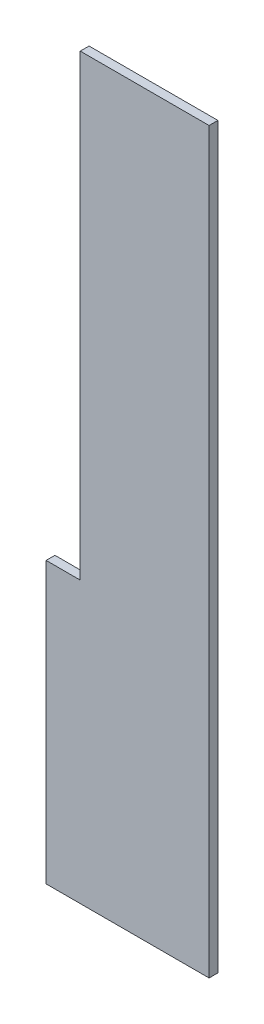
from build123d import *

# Parameters (mm, degrees)
TABAN_FLAN_1_DEPTH         = 40
KES_EKSTR_ZYON1_DEPTH      = 6158.209189235
KES_EKSTR_ZYON1_DEPTH_BACK = 6158.209189235
IZIM2_W                    = 1360
IZIM2_H                    = 355
KES_EKSTR_ZYON2_DEPTH      = 6158.209189235
KES_EKSTR_ZYON2_DEPTH_BACK = 6158.209189235
IZIM3_W                    = 365
IZIM3_H                    = 3110
IZIM3_W_2                  = 5
IZIM3_H_2                  = 5650
KES_EKSTR_ZYON3_DEPTH      = 6157.106724221
KES_EKSTR_ZYON3_DEPTH_BACK = 6157.106724221
IZIM4_W                    = 405
IZIM4_H                    = 3110
KES_EKSTR_ZYON4_DEPTH      = 6157.106724221
KES_EKSTR_ZYON4_DEPTH_BACK = 6157.106724221
KES_EKSTR_ZYON5_DEPTH      = 4928.148668348
KES_EKSTR_ZYON5_DEPTH_BACK = 4928.148668348
IZIM6_W                    = 585
IZIM6_H                    = 1030


# Sheet-metal steps are written as plain solids
with BuildPart() as part:
    # Çizim1 → Taban-Flanş1 (new body)
    with BuildSketch(Plane.XY):
        Polygon((0, 0), (0, -3465), (-660, -3465), (-660, -6005), (1360, -6005), (1360, 0), align=None)
    extrude(amount=-TABAN_FLAN_1_DEPTH)

    # Çizim2 → Kes-Ekstrüzyon1 (cut, two sides: drawn at the far end of the back side and taken through both)
    with BuildSketch(Plane.XY.offset(-KES_EKSTR_ZYON1_DEPTH_BACK)):
        with Locations((680, -177.5)):
            Rectangle(IZIM2_W, IZIM2_H)
    extrude(amount=KES_EKSTR_ZYON1_DEPTH + KES_EKSTR_ZYON1_DEPTH_BACK, mode=Mode.SUBTRACT)

    # Çizim3 → Kes-Ekstrüzyon2 (cut, two sides: drawn at the far end of the back side and taken through both)
    with BuildSketch(Plane.XY.offset(-KES_EKSTR_ZYON2_DEPTH_BACK)):
        with Locations((182.5, -1910)):
            Rectangle(IZIM3_W, IZIM3_H)
        with Locations((1357.5, -3180)):
            Rectangle(IZIM3_W_2, IZIM3_H_2)
    extrude(amount=KES_EKSTR_ZYON2_DEPTH + KES_EKSTR_ZYON2_DEPTH_BACK, mode=Mode.SUBTRACT)

    # Çizim4 → Kes-Ekstrüzyon3 (cut, two sides: drawn at the far end of the back side and taken through both)
    with BuildSketch(Plane.XY.offset(-KES_EKSTR_ZYON3_DEPTH_BACK)):
        with Locations((567.5, -1910)):
            Rectangle(IZIM4_W, IZIM4_H)
    extrude(amount=KES_EKSTR_ZYON3_DEPTH + KES_EKSTR_ZYON3_DEPTH_BACK, mode=Mode.SUBTRACT)

    # Çizim5 → Kes-Ekstrüzyon4 (cut, two sides: drawn at the far end of the back side and taken through both)
    with BuildSketch(Plane.XY.offset(-KES_EKSTR_ZYON4_DEPTH_BACK)):
        Polygon((615, -3465), (615, -4737), (1355, -4737), (1355, -6005), (-660, -6005), (-660, -3465), align=None)
    extrude(amount=KES_EKSTR_ZYON4_DEPTH + KES_EKSTR_ZYON4_DEPTH_BACK, mode=Mode.SUBTRACT)

    # Çizim6 → Kes-Ekstrüzyon5 (cut, two sides: drawn at the far end of the back side and taken through both)
    with BuildSketch(Plane.XY.offset(-KES_EKSTR_ZYON5_DEPTH_BACK)):
        with Locations((1062.5, -870)):
            Rectangle(IZIM6_W, IZIM6_H)
    extrude(amount=KES_EKSTR_ZYON5_DEPTH + KES_EKSTR_ZYON5_DEPTH_BACK, mode=Mode.SUBTRACT)


solid = part.part
